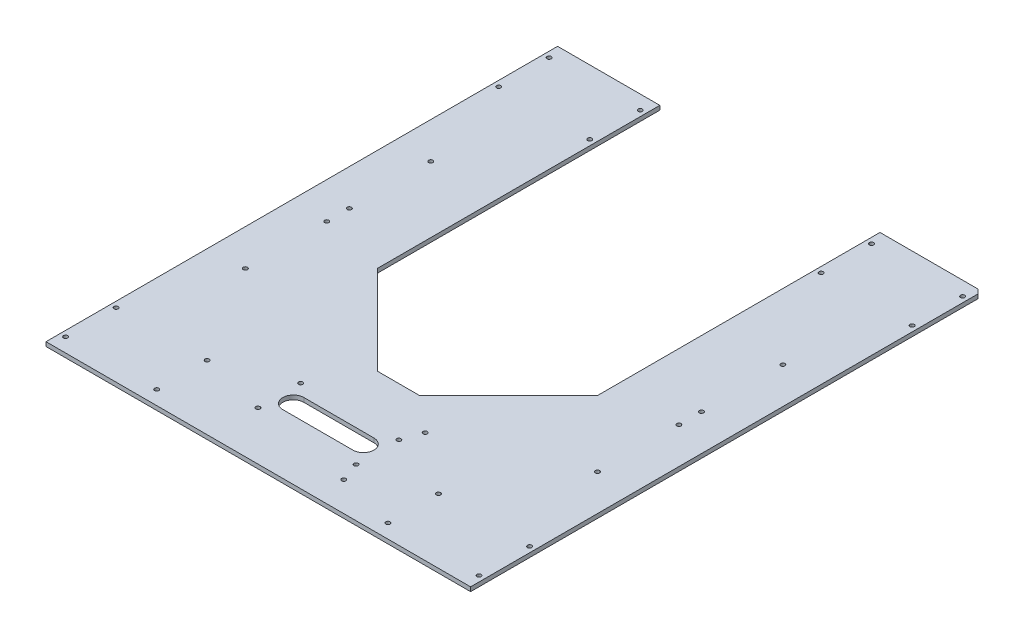
from build123d import *

# Parameters (mm, degrees)
SKETCH1_R           = 1.5
BOSS_EXTRUDE1_DEPTH = 3
CHAMFER1_SIZE       = 3


with BuildPart() as part:
    # Sketch1 → Boss-Extrude1 (new body)
    with BuildSketch(Plane(origin=(0, 0, 0), x_dir=(1, 0, 0), z_dir=(0, 1, 0))):
        Polygon((72.93, 0), (0, 0), (0, -365), (302.93, -365), (302.93, 0), (230, 0), (230, -201.465), (166.465, -265), (136.465, -265), (72.93, -201.465), align=None)
        with Locations((3.97, -355)):
            Circle(SKETCH1_R, mode=Mode.SUBTRACT)
        with Locations((68.96, -355)):
            Circle(SKETCH1_R, mode=Mode.SUBTRACT)
        with Locations((3.97, -318.99)):
            Circle(SKETCH1_R, mode=Mode.SUBTRACT)
        with Locations((68.96, -318.99)):
            Circle(SKETCH1_R, mode=Mode.SUBTRACT)
        with Locations((116.465, -330.25)):
            Circle(SKETCH1_R, mode=Mode.SUBTRACT)
        with Locations((116.465, -299.75)):
            Circle(SKETCH1_R, mode=Mode.SUBTRACT)
        with Locations((25.86, -248.64)):
            Circle(SKETCH1_R, mode=Mode.SUBTRACT)
        with Locations((25.86, -190.57)):
            Circle(SKETCH1_R, mode=Mode.SUBTRACT)
        with Locations((186.465, -330.25)):
            Circle(SKETCH1_R, mode=Mode.SUBTRACT)
        with Locations((191.465, -344.035)):
            Circle(SKETCH1_R, mode=Mode.SUBTRACT)
        with BuildLine():
            ThreePointArc((126.465, -322.5), (118.965, -315), (126.465, -307.5))
            Line((126.465, -307.5), (176.465, -307.5))
            ThreePointArc((176.465, -307.5), (183.965, -315), (176.465, -322.5))
            Line((176.465, -322.5), (126.465, -322.5))
        make_face(mode=Mode.SUBTRACT)
        with Locations((186.465, -299.75)):
            Circle(SKETCH1_R, mode=Mode.SUBTRACT)
        with Locations((191.465, -285.965)):
            Circle(SKETCH1_R, mode=Mode.SUBTRACT)
        with Locations((233.97, -355)):
            Circle(SKETCH1_R, mode=Mode.SUBTRACT)
        with Locations((298.96, -355)):
            Circle(SKETCH1_R, mode=Mode.SUBTRACT)
        with Locations((233.97, -318.99)):
            Circle(SKETCH1_R, mode=Mode.SUBTRACT)
        with Locations((298.96, -318.99)):
            Circle(SKETCH1_R, mode=Mode.SUBTRACT)
        with Locations((277.07, -248.64)):
            Circle(SKETCH1_R, mode=Mode.SUBTRACT)
        with Locations((277.07, -190.57)):
            Circle(SKETCH1_R, mode=Mode.SUBTRACT)
        with Locations((25.86, -174.43)):
            Circle(SKETCH1_R, mode=Mode.SUBTRACT)
        with Locations((25.86, -116.36)):
            Circle(SKETCH1_R, mode=Mode.SUBTRACT)
        with Locations((3.97, -46.01)):
            Circle(SKETCH1_R, mode=Mode.SUBTRACT)
        with Locations((68.96, -46.01)):
            Circle(SKETCH1_R, mode=Mode.SUBTRACT)
        with Locations((3.97, -10)):
            Circle(SKETCH1_R, mode=Mode.SUBTRACT)
        with Locations((68.96, -10)):
            Circle(SKETCH1_R, mode=Mode.SUBTRACT)
        with Locations((277.07, -174.43)):
            Circle(SKETCH1_R, mode=Mode.SUBTRACT)
        with Locations((277.07, -116.36)):
            Circle(SKETCH1_R, mode=Mode.SUBTRACT)
        with Locations((233.97, -46.01)):
            Circle(SKETCH1_R, mode=Mode.SUBTRACT)
        with Locations((298.96, -46.01)):
            Circle(SKETCH1_R, mode=Mode.SUBTRACT)
        with Locations((233.97, -10)):
            Circle(SKETCH1_R, mode=Mode.SUBTRACT)
        with Locations((298.96, -10)):
            Circle(SKETCH1_R, mode=Mode.SUBTRACT)
    extrude(amount=BOSS_EXTRUDE1_DEPTH)

    # Chamfer1
    chamfer1_edges = [part.edges().sort_by_distance(p)[0] for p in [
        (302.93, 1.5, 0),
    ]]
    chamfer(chamfer1_edges, length=CHAMFER1_SIZE)


solid = part.part
